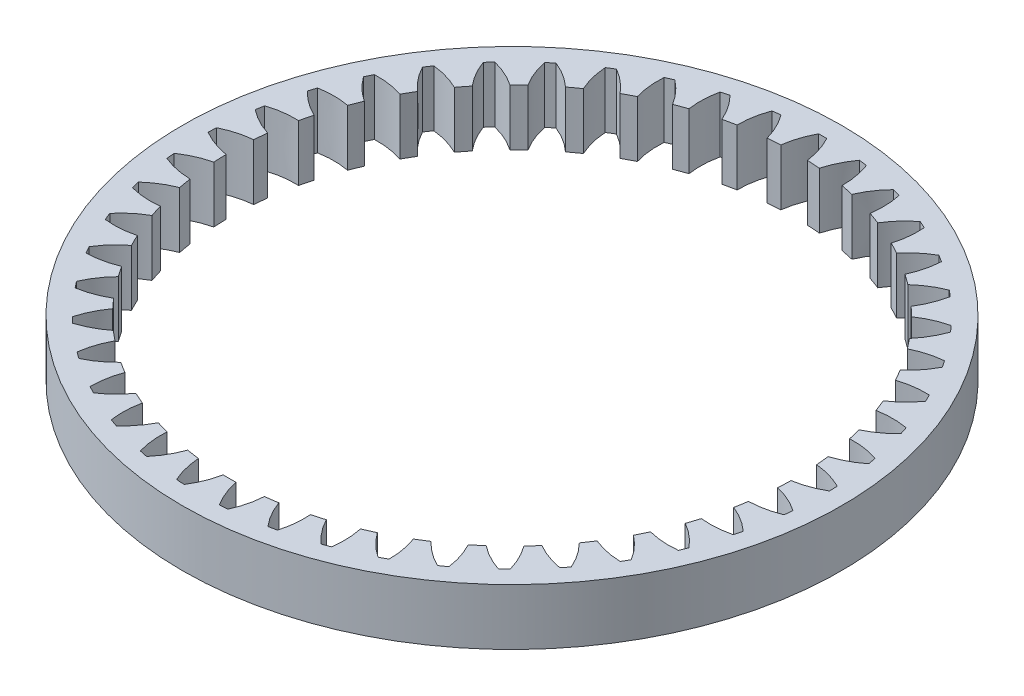
from build123d import *

# Parameters (mm, degrees)
SKETCH6_R           = 25.111661184
BOSS_EXTRUDE4_DEPTH = 5
BOSS_EXTRUDE5_DEPTH = 5
CIRPATTERN2_COUNT   = 45
SKETCH7_R           = 29.3
BOSS_EXTRUDE6_DEPTH = 5
INTERSECT2_DEPTH    = 5


# Read off the part's stored shape, not the designer's step: Intersect2
with BuildPart() as part:
    # Sketch6 → Boss-Extrude4 (new body)
    with BuildSketch(Plane(origin=(0, 0, 0), x_dir=(1, 0, 0), z_dir=(0, 1, 0))):
        with Locations(Location((0, 0, 0), (0, 0, 270))):
            Circle(SKETCH6_R)
    extrude(amount=BOSS_EXTRUDE4_DEPTH)

    # Sketch6<3> → Boss-Extrude5 (add)
    with BuildSketch(Plane(origin=(0, 0, 0), x_dir=(1, 0, 0), z_dir=(0, 1, 0))):
        with BuildLine():
            add(Edge.make_bspline(
                [(0.362032822, 27.624859454), (1.007955415, 26.42730359), (1.184519259, 25.083708688)],
                knots=[0, 0, 0, 1, 1, 1], degree=2))
            ThreePointArc((0.362032822, 27.624859454), (0, 27.627231631), (-0.362032822, 27.624859454))
            add(Edge.make_bspline(
                [(-0.362032822, 27.624859454), (-1.007955415, 26.42730359), (-1.184519259, 25.083708688)],
                knots=[0, 0, 0, 1, 1, 1], degree=2))
            ThreePointArc((-1.184519259, 25.083708688), (0, 25.111661184), (1.184519259, 25.083708688))
        make_face()
    boss_extrude5 = extrude(amount=BOSS_EXTRUDE5_DEPTH)

    # CirPattern2: Boss-Extrude5 ×45 about axis
    cirpattern2_axis = Axis((0, 5, 0), (0, -1, 0))
    for i in range(1, CIRPATTERN2_COUNT):
        add(boss_extrude5.rotate(cirpattern2_axis, i * 360 / CIRPATTERN2_COUNT))


with BuildPart() as body_2:
    # Sketch7 → Boss-Extrude6 (new body)
    with BuildSketch(Plane(origin=(0, 0, 0), x_dir=(1, 0, 0), z_dir=(0, 1, 0))):
        with Locations(Location((0, 0, 0), (0, 0, 270))):
            Circle(SKETCH7_R)
    extrude(amount=BOSS_EXTRUDE6_DEPTH)


with BuildPart() as intersect2_tool:
    # Intersect2 outline → Intersect2 (new body)
    with BuildSketch(Plane(origin=(0, 0, 0), x_dir=(1, 0, 0), z_dir=(0, 1, 0))):
        with BuildLine():
            ThreePointArc((-3.48612781, 27.406401451), (-3.844967497, 27.358365312), (-4.203146897, 27.30563099))
            add(Edge.make_bspline(
                [(-4.203146897, 27.30563099), (-4.676115852, 26.029834607), (-4.663969121, 24.674742541)],
                knots=[0, 0, 0, 1, 1, 1], degree=2))
            ThreePointArc((-4.663969121, 24.674742541), (-5.221007936, 24.562911137), (-5.775374145, 24.43850611))
            add(Edge.make_bspline(
                [(-7.26643493, 26.654509019), (-6.315443152, 25.681384833), (-5.775374145, 24.43850611)],
                knots=[0, 0, 0, 1, 1, 1], degree=2))
            ThreePointArc((-7.26643493, 26.654509019), (-7.615097075, 26.556999532), (-7.962451499, 26.454929479))
            add(Edge.make_bspline(
                [(-7.962451499, 26.454929479), (-8.253261014, 25.125724503), (-8.052640129, 23.785510597)],
                knots=[0, 0, 0, 1, 1, 1], degree=2))
            ThreePointArc((-8.052640129, 23.785510597), (-8.588693957, 23.59724271), (-9.120351279, 23.39689552))
            add(Edge.make_bspline(
                [(-10.90530916, 25.383816887), (-9.828139657, 24.552515554), (-9.120351279, 23.39689552)],
                knots=[0, 0, 0, 1, 1, 1], degree=2))
            ThreePointArc((-10.90530916, 25.383816887), (-11.237007451, 25.238731964), (-11.56677604, 25.089312857))
            add(Edge.make_bspline(
                [(-11.56677604, 25.089312857), (-11.669765838, 23.732570751), (-11.284575656, 22.433320746)],
                knots=[0, 0, 0, 1, 1, 1], degree=2))
            ThreePointArc((-11.284575656, 22.433320746), (-11.78921082, 22.172280795), (-12.28781115, 21.899890971))
            add(Edge.make_bspline(
                [(-14.331923951, 23.619057633), (-13.149542604, 22.945759488), (-12.28781115, 21.899890971)],
                knots=[0, 0, 0, 1, 1, 1], degree=2))
            ThreePointArc((-14.331923951, 23.619057633), (-14.640202259, 23.429221187), (-14.945966442, 23.2353613))
            add(Edge.make_bspline(
                [(-14.945966442, 23.2353613), (-14.859131944, 21.877489504), (-14.296869755, 20.644491823)],
                knots=[0, 0, 0, 1, 1, 1], degree=2))
            ThreePointArc((-14.296869755, 20.644491823), (-14.760264105, 20.315760655), (-15.216102753, 19.976629956))
            add(Edge.make_bspline(
                [(-17.479584145, 21.394580289), (-16.215004661, 20.892390313), (-15.216102753, 19.976629956)],
                knots=[0, 0, 0, 1, 1, 1], degree=2))
            ThreePointArc((-17.479584145, 21.394580289), (-17.758442183, 21.16368727), (-18.034250608, 20.929159864))
            add(Edge.make_bspline(
                [(-18.034250608, 20.929159864), (-17.759281949, 19.59658781), (-17.030891546, 18.45384135)],
                knots=[0, 0, 0, 1, 1, 1], degree=2))
            ThreePointArc((-17.030891546, 18.45384135), (-17.444025637, 18.063817342), (-17.848230225, 17.664546562))
            add(Edge.make_bspline(
                [(-20.287024116, 18.753681776), (-18.964860096, 18.432374526), (-17.848230225, 17.664546562)],
                knots=[0, 0, 0, 1, 1, 1], degree=2))
            ThreePointArc((-20.287024116, 18.753681776), (-20.531034229, 18.486226254), (-20.7715186, 18.215596139))
            add(Edge.make_bspline(
                [(-20.7715186, 18.215596139), (-20.313767732, 16.934260825), (-19.433426405, 15.904007846)],
                knots=[0, 0, 0, 1, 1, 1], degree=2))
            ThreePointArc((-19.433426405, 15.904007846), (-19.788259054, 15.460282372), (-20.132962198, 15.008642862))
            add(Edge.make_bspline(
                [(-22.699600239, 15.747764178), (-21.345586102, 15.613593535), (-20.132962198, 15.008642862)],
                knots=[0, 0, 0, 1, 1, 1], degree=2))
            ThreePointArc((-22.699600239, 15.747764178), (-22.904013048, 15.448951871), (-23.104492609, 15.147486554))
            add(Edge.make_bspline(
                [(-23.104492609, 15.147486554), (-22.472869132, 13.942327715), (-21.457711725, 13.04462092)],
                knots=[0, 0, 0, 1, 1, 1], degree=2))
            ThreePointArc((-21.457711725, 13.04462092), (-21.747336516, 12.555830592), (-22.025828962, 12.060613001))
            add(Edge.make_bspline(
                [(-24.670354464, 12.435334264), (-23.310844555, 12.490911707), (-22.025828962, 12.060613001)],
                knots=[0, 0, 0, 1, 1, 1], degree=2))
            ThreePointArc((-24.670354464, 12.435334264), (-24.831191306, 12.110981213), (-24.987763951, 11.784548374))
            add(Edge.make_bspline(
                [(-24.987763951, 11.784548374), (-24.194561697, 10.679023056), (-23.064347094, 9.931335286)],
                knots=[0, 0, 0, 1, 1, 1], degree=2))
            ThreePointArc((-23.064347094, 9.931335286), (-23.283126811, 9.406993851), (-23.489988019, 8.877837026))
            add(Edge.make_bspline(
                [(-26.160928301, 8.880864713), (-24.822383935, 9.12510849), (-23.489988019, 8.877837026)],
                knots=[0, 0, 0, 1, 1, 1], degree=2))
            ThreePointArc((-26.160928301, 8.880864713), (-26.27505867, 8.537284082), (-26.38467689, 8.192237364))
            add(Edge.make_bspline(
                [(-26.38467689, 8.192237364), (-25.44533464, 7.20786336), (-24.222061182, 6.624747507)],
                knots=[0, 0, 0, 1, 1, 1], degree=2))
            ThreePointArc((-24.222061182, 6.624747507), (-24.365737526, 6.075060676), (-24.496941179, 5.522264053))
            add(Edge.make_bspline(
                [(-27.142309426, 5.153539233), (-25.850783846, 5.581695416), (-24.496941179, 5.522264053)],
                knots=[0, 0, 0, 1, 1, 1], degree=2))
            ThreePointArc((-27.142309426, 5.153539233), (-27.207511905, 4.797418427), (-27.268042106, 4.440473772))
            add(Edge.make_bspline(
                [(-27.268042106, 4.440473772), (-26.200843087, 3.596410802), (-24.908320401, 3.189216553)],
                knots=[0, 0, 0, 1, 1, 1], degree=2))
            ThreePointArc((-24.908320401, 3.189216553), (-24.974096876, 2.624883353), (-25.027089244, 2.05920649))
            add(Edge.make_bspline(
                [(-27.595396373, 1.325905973), (-26.376027654, 1.92964099), (-25.027089244, 2.05920649)],
                knots=[0, 0, 0, 1, 1, 1], degree=2))
            ThreePointArc((-27.595396373, 1.325905973), (-27.610401868, 0.964176479), (-27.620665899, 0.60228141))
            add(Edge.make_bspline(
                [(-27.620665899, 0.60228141), (-26.446381927, -0.085041801), (-25.109767496, -0.308388873)],
                knots=[0, 0, 0, 1, 1, 1], degree=2))
            ThreePointArc((-25.109767496, -0.308388873), (-25.096363838, -0.876384337), (-25.070113485, -1.443931184))
            add(Edge.make_bspline(
                [(-27.511370318, -2.527534538), (-26.387892086, -1.759971703), (-25.070113485, -1.443931184)],
                knots=[0, 0, 0, 1, 1, 1], degree=2))
            ThreePointArc((-27.511370318, -2.527534538), (-27.475886766, -2.887832067), (-27.435684849, -3.247633675))
            add(Edge.make_bspline(
                [(-27.435684849, -3.247633675), (-26.177172025, -3.764839162), (-24.822481529, -3.799991861)],
                knots=[0, 0, 0, 1, 1, 1], degree=2))
            ThreePointArc((-24.822481529, -3.799991861), (-24.730158625, -4.360594203), (-24.625176483, -4.91896438))
            add(Edge.make_bspline(
                [(-26.891866734, -6.331779465), (-25.886146215, -5.415328549), (-24.625176483, -4.91896438)],
                knots=[0, 0, 0, 1, 1, 1], degree=2))
            ThreePointArc((-26.891866734, -6.331779465), (-26.806584781, -6.683632247), (-26.716699401, -7.034337265))
            add(Edge.make_bspline(
                [(-26.716699401, -7.034337265), (-25.398453246, -7.371358211), (-24.052054194, -7.217632329)],
                knots=[0, 0, 0, 1, 1, 1], degree=2))
            ThreePointArc((-24.052054194, -7.217632329), (-23.882609004, -7.759930063), (-23.700938432, -8.298255529))
            add(Edge.make_bspline(
                [(-25.748943553, -10.012783506), (-24.880555952, -8.965282184), (-23.700938432, -8.298255529)],
                knots=[0, 0, 0, 1, 1, 1], degree=2))
            ThreePointArc((-25.748943553, -10.012783506), (-25.615523115, -10.349343127), (-25.477703788, -10.684125481))
            add(Edge.make_bspline(
                [(-25.477703788, -10.684125481), (-24.125382464, -10.834402157), (-22.813480984, -10.494789794)],
                knots=[0, 0, 0, 1, 1, 1], degree=2))
            ThreePointArc((-22.813480984, -10.494789794), (-22.570211565, -11.008227711), (-22.315388574, -11.516030574))
            add(Edge.make_bspline(
                [(-24.104846474, -13.498900106), (-23.39069397, -12.3407368), (-22.315388574, -11.516030574)],
                knots=[0, 0, 0, 1, 1, 1], degree=2))
            ThreePointArc((-24.104846474, -13.498900106), (-23.925884429, -13.813615816), (-23.742813652, -14.125959348))
            add(Edge.make_bspline(
                [(-23.742813652, -14.125959348), (-22.382738555, -14.08656679), (-21.130869315, -13.567678113)],
                knots=[0, 0, 0, 1, 1, 1], degree=2))
            ThreePointArc((-21.130869315, -13.567678113), (-20.818510631, -14.042262728), (-20.495495061, -14.509659183))
            add(Edge.make_bspline(
                [(-21.991575978, -16.72227597), (-21.445558735, -15.475993011), (-20.495495061, -14.509659183)],
                knots=[0, 0, 0, 1, 1, 1], degree=2))
            ThreePointArc((-21.991575978, -16.72227597), (-21.770555618, -17.009022185), (-21.545796655, -17.292847484))
            add(Edge.make_bspline(
                [(-21.545796655, -17.292847484), (-20.2044401, -17.064552423), (-19.036969312, -16.376487011)],
                knots=[0, 0, 0, 1, 1, 1], degree=2))
            ThreePointArc((-19.036969312, -16.376487011), (-18.661601068, -16.802981075), (-18.276680049, -17.220873781))
            add(Edge.make_bspline(
                [(-19.450264471, -19.620171754), (-19.083010094, -18.310026622), (-18.276680049, -17.220873781)],
                knots=[0, 0, 0, 1, 1, 1], degree=2))
            ThreePointArc((-19.450264471, -19.620171754), (-19.191487705, -19.873367286), (-18.929415234, -20.123150014))
            add(Edge.make_bspline(
                [(-18.929415234, -20.123150014), (-17.632885201, -19.710395954), (-16.572536355, -18.866546217)],
                knots=[0, 0, 0, 1, 1, 1], degree=2))
            ThreePointArc((-16.572536355, -18.866546217), (-16.141464668, -19.236648507), (-15.70213025, -19.596903659))
            add(Edge.make_bspline(
                [(-16.530375689, -22.136183212), (-16.349032368, -20.787676392), (-15.70213025, -19.596903659)],
                knots=[0, 0, 0, 1, 1, 1], degree=2))
            ThreePointArc((-16.530375689, -22.136183212), (-16.238879314, -22.350899897), (-15.944594278, -22.561778319))
            add(Edge.make_bspline(
                [(-15.944594278, -22.561778319), (-14.718126248, -21.972599047), (-13.785537829, -20.989389562)],
                knots=[0, 0, 0, 1, 1, 1], degree=2))
            ThreePointArc((-13.785537829, -20.989389562), (-13.307153018, -21.295896458), (-12.821956347, -21.591502098))
            add(Edge.make_bspline(
                [(-13.288741949, -24.221339043), (-13.296839323, -22.860717687), (-12.821956347, -21.591502098)],
                knots=[0, 0, 0, 1, 1, 1], degree=2))
            ThreePointArc((-13.288741949, -24.221339043), (-12.97019961, -24.393397666), (-12.649429931, -24.561267273))
            add(Edge.make_bspline(
                [(-12.649429931, -24.561267273), (-11.51689571, -23.807130494), (-10.73021949, -22.703698314)],
                knots=[0, 0, 0, 1, 1, 1], degree=2))
            ThreePointArc((-10.73021949, -22.703698314), (-10.213832772, -22.940644008), (-9.692217647, -23.165846509))
            add(Edge.make_bspline(
                [(-9.788457961, -25.835054061), (-9.985838427, -24.488801115), (-9.692217647, -23.165846509)],
                knots=[0, 0, 0, 1, 1, 1], degree=2))
            ThreePointArc((-9.788457961, -25.835054061), (-9.449069722, -25.961105697), (-9.108058818, -26.082699097))
            add(Edge.make_bspline(
                [(-9.108058818, -26.082699097), (-8.091501896, -25.178283226), (-7.466049634, -23.976105403)],
                knots=[0, 0, 0, 1, 1, 1], degree=2))
            ThreePointArc((-7.466049634, -23.976105403), (-6.921711889, -24.138878017), (-6.373830956, -24.289294069))
            add(Edge.make_bspline(
                [(-6.097652774, -26.945919139), (-6.480474543, -25.640237886), (-6.373830956, -24.289294069)],
                knots=[0, 0, 0, 1, 1, 1], degree=2))
            ThreePointArc((-6.097652774, -26.945919139), (-5.744024441, -27.023510335), (-5.389409701, -27.096460852))
            add(Edge.make_bspline(
                [(-5.389409701, -27.096460852), (-4.508616203, -26.059369315), (-4.056561614, -24.781844872)],
                knots=[0, 0, 0, 1, 1, 1], degree=2))
            ThreePointArc((-4.056561614, -24.781844872), (-3.494867757, -24.867276223), (-2.931384896, -24.939978148))
            add(Edge.make_bspline(
                [(-2.288163712, -27.532312552), (-2.848975595, -26.292616591), (-2.931384896, -24.939978148)],
                knots=[0, 0, 0, 1, 1, 1], degree=2))
            ThreePointArc((-2.288163712, -27.532312552), (-1.927178258, -27.559933084), (-1.565861855, -27.582820818))
            add(Edge.make_bspline(
                [(-1.565861855, -27.582820818), (-0.837975423, -26.433239422), (-0.568117237, -25.105233921)],
                knots=[0, 0, 0, 1, 1, 1], degree=2))
            ThreePointArc((-0.568117237, -25.105233921), (0, -25.111661184), (0.568117237, -25.105233921))
            add(Edge.make_bspline(
                [(1.565861855, -27.582820818), (0.837975423, -26.433239422), (0.568117237, -25.105233921)],
                knots=[0, 0, 0, 1, 1, 1], degree=2))
            ThreePointArc((1.565861855, -27.582820818), (1.927178258, -27.559933084), (2.288163712, -27.532312552))
            add(Edge.make_bspline(
                [(2.288163712, -27.532312552), (2.848975595, -26.292616591), (2.931384896, -24.939978148)],
                knots=[0, 0, 0, 1, 1, 1], degree=2))
            ThreePointArc((2.931384896, -24.939978148), (3.494867757, -24.867276223), (4.056561614, -24.781844872))
            add(Edge.make_bspline(
                [(5.389409701, -27.096460852), (4.508616203, -26.059369315), (4.056561614, -24.781844872)],
                knots=[0, 0, 0, 1, 1, 1], degree=2))
            ThreePointArc((5.389409701, -27.096460852), (5.744024441, -27.023510335), (6.097652774, -26.945919139))
            add(Edge.make_bspline(
                [(6.097652774, -26.945919139), (6.480474543, -25.640237886), (6.373830956, -24.289294069)],
                knots=[0, 0, 0, 1, 1, 1], degree=2))
            ThreePointArc((6.373830956, -24.289294069), (6.921711889, -24.138878017), (7.466049634, -23.976105403))
            add(Edge.make_bspline(
                [(9.108058818, -26.082699097), (8.091501896, -25.178283226), (7.466049634, -23.976105403)],
                knots=[0, 0, 0, 1, 1, 1], degree=2))
            ThreePointArc((9.108058818, -26.082699097), (9.449069722, -25.961105697), (9.788457961, -25.835054061))
            add(Edge.make_bspline(
                [(9.788457961, -25.835054061), (9.985838427, -24.488801115), (9.692217647, -23.165846509)],
                knots=[0, 0, 0, 1, 1, 1], degree=2))
            ThreePointArc((9.692217647, -23.165846509), (10.213832772, -22.940644008), (10.73021949, -22.703698314))
            add(Edge.make_bspline(
                [(12.649429931, -24.561267273), (11.51689571, -23.807130494), (10.73021949, -22.703698314)],
                knots=[0, 0, 0, 1, 1, 1], degree=2))
            ThreePointArc((12.649429931, -24.561267273), (12.97019961, -24.393397666), (13.288741949, -24.221339043))
            add(Edge.make_bspline(
                [(13.288741949, -24.221339043), (13.296839323, -22.860717687), (12.821956347, -21.591502098)],
                knots=[0, 0, 0, 1, 1, 1], degree=2))
            ThreePointArc((12.821956347, -21.591502098), (13.307153018, -21.295896458), (13.785537829, -20.989389562))
            add(Edge.make_bspline(
                [(15.944594278, -22.561778319), (14.718126248, -21.972599047), (13.785537829, -20.989389562)],
                knots=[0, 0, 0, 1, 1, 1], degree=2))
            ThreePointArc((15.944594278, -22.561778319), (16.238879314, -22.350899897), (16.530375689, -22.136183212))
            add(Edge.make_bspline(
                [(16.530375689, -22.136183212), (16.349032368, -20.787676392), (15.70213025, -19.596903659)],
                knots=[0, 0, 0, 1, 1, 1], degree=2))
            ThreePointArc((15.70213025, -19.596903659), (16.141464668, -19.236648507), (16.572536355, -18.866546217))
            add(Edge.make_bspline(
                [(18.929415234, -20.123150014), (17.632885201, -19.710395954), (16.572536355, -18.866546217)],
                knots=[0, 0, 0, 1, 1, 1], degree=2))
            ThreePointArc((18.929415234, -20.123150014), (19.191487705, -19.873367286), (19.450264471, -19.620171754))
            add(Edge.make_bspline(
                [(19.450264471, -19.620171754), (19.083010094, -18.310026622), (18.276680049, -17.220873781)],
                knots=[0, 0, 0, 1, 1, 1], degree=2))
            ThreePointArc((18.276680049, -17.220873781), (18.661601068, -16.802981075), (19.036969312, -16.376487011))
            add(Edge.make_bspline(
                [(21.545796655, -17.292847484), (20.2044401, -17.064552423), (19.036969312, -16.376487011)],
                knots=[0, 0, 0, 1, 1, 1], degree=2))
            ThreePointArc((21.545796655, -17.292847484), (21.770555618, -17.009022185), (21.991575978, -16.72227597))
            add(Edge.make_bspline(
                [(21.991575978, -16.72227597), (21.445558735, -15.475993011), (20.495495061, -14.509659183)],
                knots=[0, 0, 0, 1, 1, 1], degree=2))
            ThreePointArc((20.495495061, -14.509659183), (20.818510631, -14.042262728), (21.130869315, -13.567678113))
            add(Edge.make_bspline(
                [(23.742813652, -14.125959348), (22.382738555, -14.08656679), (21.130869315, -13.567678113)],
                knots=[0, 0, 0, 1, 1, 1], degree=2))
            ThreePointArc((23.742813652, -14.125959348), (23.925884429, -13.813615816), (24.104846474, -13.498900106))
            add(Edge.make_bspline(
                [(24.104846474, -13.498900106), (23.39069397, -12.3407368), (22.315388574, -11.516030574)],
                knots=[0, 0, 0, 1, 1, 1], degree=2))
            ThreePointArc((22.315388574, -11.516030574), (22.570211565, -11.008227711), (22.813480984, -10.494789794))
            add(Edge.make_bspline(
                [(25.477703788, -10.684125481), (24.125382464, -10.834402157), (22.813480984, -10.494789794)],
                knots=[0, 0, 0, 1, 1, 1], degree=2))
            ThreePointArc((25.477703788, -10.684125481), (25.615523115, -10.349343127), (25.748943553, -10.012783506))
            add(Edge.make_bspline(
                [(25.748943553, -10.012783506), (24.880555952, -8.965282184), (23.700938432, -8.298255529)],
                knots=[0, 0, 0, 1, 1, 1], degree=2))
            ThreePointArc((23.700938432, -8.298255529), (23.882609004, -7.759930063), (24.052054194, -7.217632329))
            add(Edge.make_bspline(
                [(26.716699401, -7.034337265), (25.398453246, -7.371358211), (24.052054194, -7.217632329)],
                knots=[0, 0, 0, 1, 1, 1], degree=2))
            ThreePointArc((26.716699401, -7.034337265), (26.806584781, -6.683632247), (26.891866734, -6.331779465))
            add(Edge.make_bspline(
                [(26.891866734, -6.331779465), (25.886146215, -5.415328549), (24.625176483, -4.91896438)],
                knots=[0, 0, 0, 1, 1, 1], degree=2))
            ThreePointArc((24.625176483, -4.91896438), (24.730158625, -4.360594203), (24.822481529, -3.799991861))
            add(Edge.make_bspline(
                [(27.435684849, -3.247633675), (26.177172025, -3.764839162), (24.822481529, -3.799991861)],
                knots=[0, 0, 0, 1, 1, 1], degree=2))
            ThreePointArc((27.435684849, -3.247633675), (27.475886766, -2.887832067), (27.511370318, -2.527534538))
            add(Edge.make_bspline(
                [(27.511370318, -2.527534538), (26.387892086, -1.759971703), (25.070113485, -1.443931184)],
                knots=[0, 0, 0, 1, 1, 1], degree=2))
            ThreePointArc((25.070113485, -1.443931184), (25.096363838, -0.876384337), (25.109767496, -0.308388873))
            add(Edge.make_bspline(
                [(27.620665899, 0.60228141), (26.446381927, -0.085041801), (25.109767496, -0.308388873)],
                knots=[0, 0, 0, 1, 1, 1], degree=2))
            ThreePointArc((27.620665899, 0.60228141), (27.610401868, 0.964176479), (27.595396373, 1.325905973))
            add(Edge.make_bspline(
                [(27.595396373, 1.325905973), (26.376027654, 1.92964099), (25.027089244, 2.05920649)],
                knots=[0, 0, 0, 1, 1, 1], degree=2))
            ThreePointArc((25.027089244, 2.05920649), (24.974096876, 2.624883353), (24.908320401, 3.189216553))
            add(Edge.make_bspline(
                [(27.268042106, 4.440473772), (26.200843087, 3.596410802), (24.908320401, 3.189216553)],
                knots=[0, 0, 0, 1, 1, 1], degree=2))
            ThreePointArc((27.268042106, 4.440473772), (27.207511905, 4.797418427), (27.142309426, 5.153539233))
            add(Edge.make_bspline(
                [(27.142309426, 5.153539233), (25.850783846, 5.581695416), (24.496941179, 5.522264053)],
                knots=[0, 0, 0, 1, 1, 1], degree=2))
            ThreePointArc((24.496941179, 5.522264053), (24.365737526, 6.075060676), (24.222061182, 6.624747507))
            add(Edge.make_bspline(
                [(26.38467689, 8.192237364), (25.44533464, 7.20786336), (24.222061182, 6.624747507)],
                knots=[0, 0, 0, 1, 1, 1], degree=2))
            ThreePointArc((26.38467689, 8.192237364), (26.27505867, 8.537284082), (26.160928301, 8.880864713))
            add(Edge.make_bspline(
                [(26.160928301, 8.880864713), (24.822383935, 9.12510849), (23.489988019, 8.877837026)],
                knots=[0, 0, 0, 1, 1, 1], degree=2))
            ThreePointArc((23.489988019, 8.877837026), (23.283126811, 9.406993851), (23.064347094, 9.931335286))
            add(Edge.make_bspline(
                [(24.987763951, 11.784548374), (24.194561697, 10.679023056), (23.064347094, 9.931335286)],
                knots=[0, 0, 0, 1, 1, 1], degree=2))
            ThreePointArc((24.987763951, 11.784548374), (24.831191306, 12.110981213), (24.670354464, 12.435334264))
            add(Edge.make_bspline(
                [(24.670354464, 12.435334264), (23.310844555, 12.490911707), (22.025828962, 12.060613001)],
                knots=[0, 0, 0, 1, 1, 1], degree=2))
            ThreePointArc((22.025828962, 12.060613001), (21.747336516, 12.555830592), (21.457711725, 13.04462092))
            add(Edge.make_bspline(
                [(23.104492609, 15.147486554), (22.472869132, 13.942327715), (21.457711725, 13.04462092)],
                knots=[0, 0, 0, 1, 1, 1], degree=2))
            ThreePointArc((23.104492609, 15.147486554), (22.904013048, 15.448951871), (22.699600239, 15.747764178))
            add(Edge.make_bspline(
                [(22.699600239, 15.747764178), (21.345586102, 15.613593535), (20.132962198, 15.008642862)],
                knots=[0, 0, 0, 1, 1, 1], degree=2))
            ThreePointArc((20.132962198, 15.008642862), (19.788259054, 15.460282372), (19.433426405, 15.904007846))
            add(Edge.make_bspline(
                [(20.7715186, 18.215596139), (20.313767732, 16.934260825), (19.433426405, 15.904007846)],
                knots=[0, 0, 0, 1, 1, 1], degree=2))
            ThreePointArc((20.7715186, 18.215596139), (20.531034229, 18.486226254), (20.287024116, 18.753681776))
            add(Edge.make_bspline(
                [(20.287024116, 18.753681776), (18.964860096, 18.432374526), (17.848230225, 17.664546562)],
                knots=[0, 0, 0, 1, 1, 1], degree=2))
            ThreePointArc((17.848230225, 17.664546562), (17.444025637, 18.063817342), (17.030891546, 18.45384135))
            add(Edge.make_bspline(
                [(18.034250608, 20.929159864), (17.759281949, 19.59658781), (17.030891546, 18.45384135)],
                knots=[0, 0, 0, 1, 1, 1], degree=2))
            ThreePointArc((18.034250608, 20.929159864), (17.758442183, 21.16368727), (17.479584145, 21.394580289))
            add(Edge.make_bspline(
                [(17.479584145, 21.394580289), (16.215004661, 20.892390313), (15.216102753, 19.976629956)],
                knots=[0, 0, 0, 1, 1, 1], degree=2))
            ThreePointArc((15.216102753, 19.976629956), (14.760264105, 20.315760655), (14.296869755, 20.644491823))
            add(Edge.make_bspline(
                [(14.945966442, 23.2353613), (14.859131944, 21.877489504), (14.296869755, 20.644491823)],
                knots=[0, 0, 0, 1, 1, 1], degree=2))
            ThreePointArc((14.945966442, 23.2353613), (14.640202259, 23.429221187), (14.331923951, 23.619057633))
            add(Edge.make_bspline(
                [(14.331923951, 23.619057633), (13.149542604, 22.945759488), (12.28781115, 21.899890971)],
                knots=[0, 0, 0, 1, 1, 1], degree=2))
            ThreePointArc((12.28781115, 21.899890971), (11.78921082, 22.172280795), (11.284575656, 22.433320746))
            add(Edge.make_bspline(
                [(11.56677604, 25.089312857), (11.669765838, 23.732570751), (11.284575656, 22.433320746)],
                knots=[0, 0, 0, 1, 1, 1], degree=2))
            ThreePointArc((11.56677604, 25.089312857), (11.237007451, 25.238731964), (10.90530916, 25.383816887))
            add(Edge.make_bspline(
                [(10.90530916, 25.383816887), (9.828139657, 24.552515554), (9.120351279, 23.39689552)],
                knots=[0, 0, 0, 1, 1, 1], degree=2))
            ThreePointArc((9.120351279, 23.39689552), (8.588693957, 23.59724271), (8.052640129, 23.785510597))
            add(Edge.make_bspline(
                [(7.962451499, 26.454929479), (8.253261014, 25.125724503), (8.052640129, 23.785510597)],
                knots=[0, 0, 0, 1, 1, 1], degree=2))
            ThreePointArc((7.962451499, 26.454929479), (7.615097075, 26.556999532), (7.26643493, 26.654509019))
            add(Edge.make_bspline(
                [(7.26643493, 26.654509019), (6.315443152, 25.681384833), (5.775374145, 24.43850611)],
                knots=[0, 0, 0, 1, 1, 1], degree=2))
            ThreePointArc((5.775374145, 24.43850611), (5.221007936, 24.562911137), (4.663969121, 24.674742541))
            add(Edge.make_bspline(
                [(4.203146897, 27.30563099), (4.676115852, 26.029834607), (4.663969121, 24.674742541)],
                knots=[0, 0, 0, 1, 1, 1], degree=2))
            ThreePointArc((4.203146897, 27.30563099), (3.844967497, 27.358365312), (3.48612781, 27.406401451))
            add(Edge.make_bspline(
                [(3.48612781, 27.406401451), (2.679823729, 26.310395169), (2.317985923, 25.004448978)],
                knots=[0, 0, 0, 1, 1, 1], degree=2))
            ThreePointArc((2.317985923, 25.004448978), (1.751700934, 25.050490439), (1.184519259, 25.083708688))
            add(Edge.make_bspline(
                [(0.362032822, 27.624859454), (1.007955415, 26.42730359), (1.184519259, 25.083708688)],
                knots=[0, 0, 0, 1, 1, 1], degree=2))
            ThreePointArc((0.362032822, 27.624859454), (0, 27.627231631), (-0.362032822, 27.624859454))
            add(Edge.make_bspline(
                [(-0.362032822, 27.624859454), (-1.007955415, 26.42730359), (-1.184519259, 25.083708688)],
                knots=[0, 0, 0, 1, 1, 1], degree=2))
            ThreePointArc((-1.184519259, 25.083708688), (-1.751700934, 25.050490439), (-2.317985923, 25.004448978))
            add(Edge.make_bspline(
                [(-3.48612781, 27.406401451), (-2.679823729, 26.310395169), (-2.317985923, 25.004448978)],
                knots=[0, 0, 0, 1, 1, 1], degree=2))
        make_face()
    extrude(amount=INTERSECT2_DEPTH)


with BuildPart() as part_1:
    add(part.part)

    # Intersect2: cut by intersect2_tool
    add(intersect2_tool.part, mode=Mode.SUBTRACT)


with BuildPart() as body_2_1:
    add(body_2.part)

    # Intersect2: cut by intersect2_tool
    add(intersect2_tool.part, mode=Mode.SUBTRACT)


solid = body_2_1.part
